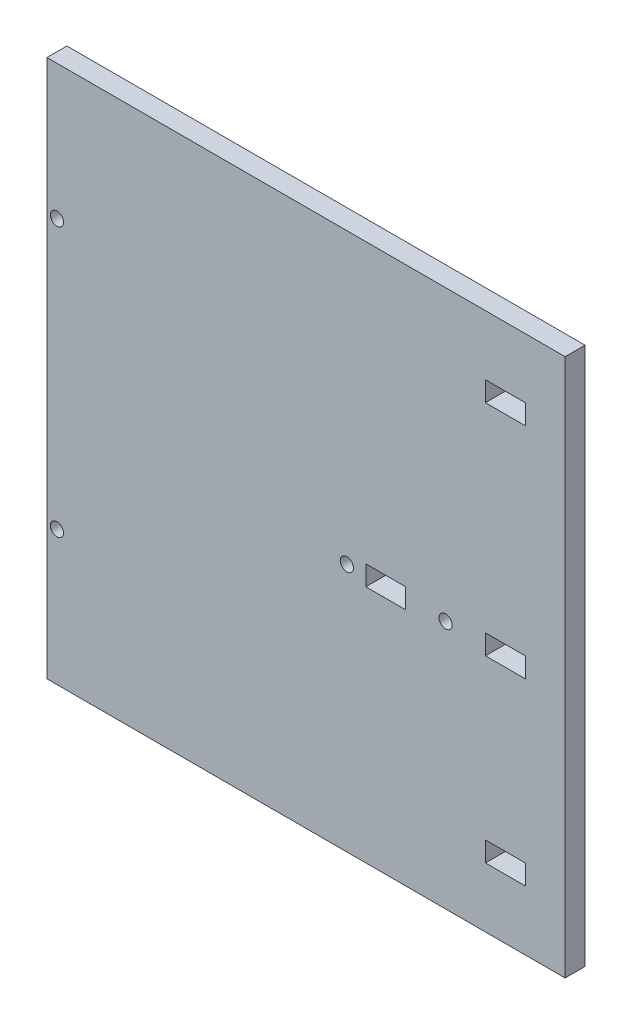
from build123d import *

# Parameters (mm, degrees)
SKETCH1_W           = 165.1
SKETCH1_H           = 171.45
BOSS_EXTRUDE1_DEPTH = 6.35
SKETCH2_R           = 2.0955
SKETCH2_W           = 12.7
SKETCH2_H           = 6.35
CUT_EXTRUDE1_DEPTH  = 223.363363945
SKETCH3_W           = 12.7
SKETCH3_H           = 6.35
CUT_EXTRUDE2_DEPTH  = 223.363363945
SKETCH4_R           = 2.0955
CUT_EXTRUDE3_DEPTH  = 223.363363945


with BuildPart() as part:
    # Sketch1 → Boss-Extrude1 (new body)
    with BuildSketch(Plane.XY):
        with Locations((76.2, 69.85)):
            Rectangle(SKETCH1_W, SKETCH1_H)
    extrude(amount=BOSS_EXTRUDE1_DEPTH)

    # Sketch2 → Cut-Extrude1 (cut, through all)
    with BuildSketch(Plane.XY.offset(6.35)):
        with Locations((120.65, 63.5)):
            Circle(SKETCH2_R)
        with Locations((89.190901447, 63.5)):
            Circle(SKETCH2_R)
        with Locations((139.7, 63.5)):
            Rectangle(SKETCH2_W, SKETCH2_H)
        with Locations((101.6, 63.5)):
            Rectangle(SKETCH2_W, SKETCH2_H)
    extrude(amount=-CUT_EXTRUDE1_DEPTH, mode=Mode.SUBTRACT)

    # Sketch3 → Cut-Extrude2 (cut, through all)
    with BuildSketch(Plane.XY.offset(6.35)):
        with Locations((139.7, 6.35)):
            Rectangle(SKETCH3_W, SKETCH3_H)
        with Locations((139.7, 133.35)):
            Rectangle(SKETCH3_W, SKETCH3_H)
    extrude(amount=-CUT_EXTRUDE2_DEPTH, mode=Mode.SUBTRACT)

    # Sketch4 → Cut-Extrude3 (cut, through all)
    with BuildSketch(Plane(origin=(0, 0, 0), x_dir=(-1, 0, 0), z_dir=(0, 0, -1))):
        with Locations((3.175, 26.9875)):
            Circle(SKETCH4_R)
        with Locations((3.175, 112.7125)):
            Circle(SKETCH4_R)
    extrude(amount=-CUT_EXTRUDE3_DEPTH, mode=Mode.SUBTRACT)


solid = part.part
